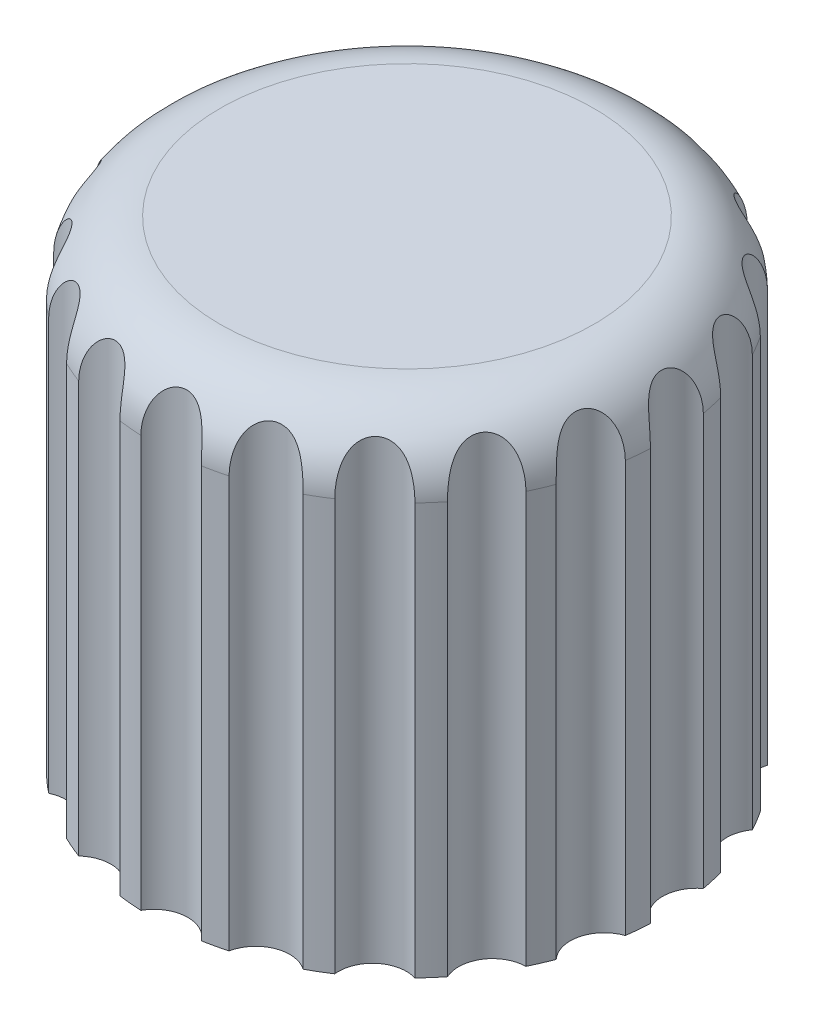
from build123d import *

# Parameters (mm, degrees)
SKETCH1_R           = 7.5
SKETCH1_R_2         = 5.25
SKETCH1_W           = 1
SKETCH1_H           = 14.966629548
BOSS_EXTRUDE1_DEPTH = 12.1
SKETCH4_R           = 7.5
BOSS_EXTRUDE2_DEPTH = 2
FILLET1_R           = 2
CUT_EXTRUDE1_DEPTH  = 20


with BuildPart() as part:
    # Sketch1 → Boss-Extrude1 (new body)
    # profile 1 of 2: a face of its own
    with BuildSketch(Plane(origin=(0, 0, 0), x_dir=(1, 0, 0), z_dir=(0, 1, 0))):
        Circle(SKETCH1_R)
        Circle(SKETCH1_R_2, mode=Mode.SUBTRACT)
    # profile 2 of 2: a face of its own
    with BuildSketch(Plane(origin=(0, 0, 0), x_dir=(1, 0, 0), z_dir=(0, 1, 0))):
        Rectangle(SKETCH1_W, SKETCH1_H)
    extrude(amount=BOSS_EXTRUDE1_DEPTH)

    # Sketch4 → Boss-Extrude2 (add)
    with BuildSketch(Plane(origin=(0, 12.1, 0), x_dir=(1, 0, 0), z_dir=(0, 1, 0))):
        Circle(SKETCH4_R)
    extrude(amount=BOSS_EXTRUDE2_DEPTH)

    # Fillet1
    fillet1_edges = [part.edges().sort_by_distance(p)[0] for p in [
        (-7.5, 14.1, 0),
    ]]
    fillet(fillet1_edges, radius=FILLET1_R)

    # Sketch5 → Cut-Extrude1 (cut)
    with BuildSketch(Plane(origin=(0, 14.1, 0), x_dir=(1, 0, 0), z_dir=(0, 1, 0))):
        with BuildLine():
            ThreePointArc((7.986628338, -0.462350289), (7.981913601, 0.537638597), (7.852481465, 1.529226879))
            ThreePointArc((7.852481465, 1.529226879), (6.984174401, 0.470433772), (7.986628338, -0.462350289))
        make_face()
        with BuildLine():
            ThreePointArc((6.995596572, 3.880931409), (6.496972545, 2.605637686), (7.738609021, 2.028282629))
            ThreePointArc((7.738609021, 2.028282629), (7.42511148, 2.977871641), (6.995596572, 3.880931409))
        make_face()
        with BuildLine():
            ThreePointArc((7.452860828, -2.907725139), (7.757390406, -1.955222259), (7.94071076, -0.972169032))
            ThreePointArc((7.94071076, -0.972169032), (6.787716606, -1.710819477), (7.452860828, -2.907725139))
        make_face()
        with BuildLine():
            ThreePointArc((5.453933946, 5.852743332), (5.373801749, 4.485783629), (6.733080734, 4.320373112))
            ThreePointArc((6.733080734, 4.320373112), (6.141487713, 5.126609862), (5.453933946, 5.852743332))
        make_face()
        with BuildLine():
            ThreePointArc((6.189555372, -5.068471594), (6.773519789, -4.256692338), (7.25164796, -3.378402265))
            ThreePointArc((7.25164796, -3.378402265), (5.926829816, -3.724605796), (6.189555372, -5.068471594))
        make_face()
        with BuildLine():
            ThreePointArc((3.378402265, 7.25164796), (3.724605796, 5.926829816), (5.068471594, 6.189555372))
            ThreePointArc((5.068471594, 6.189555372), (4.256692338, 6.773519789), (3.378402265, 7.25164796))
        make_face()
        with BuildLine():
            ThreePointArc((4.320373112, -6.733080734), (5.126609862, -6.141487713), (5.852743332, -5.453933946))
            ThreePointArc((5.852743332, -5.453933946), (4.485783629, -5.373801749), (4.320373112, -6.733080734))
        make_face()
        with BuildLine():
            ThreePointArc((0.972169032, 7.94071076), (1.710819477, 6.787716606), (2.907725139, 7.452860828))
            ThreePointArc((2.907725139, 7.452860828), (1.955222259, 7.757390406), (0.972169032, 7.94071076))
        make_face()
        with BuildLine():
            ThreePointArc((2.028282629, -7.738609021), (2.977871641, -7.42511148), (3.880931409, -6.995596572))
            ThreePointArc((3.880931409, -6.995596572), (2.605637686, -6.496972545), (2.028282629, -7.738609021))
        make_face()
        with BuildLine():
            ThreePointArc((-1.529226879, 7.852481465), (-0.470433772, 6.984174401), (0.462350289, 7.986628338))
            ThreePointArc((0.462350289, 7.986628338), (-0.537638597, 7.981913601), (-1.529226879, 7.852481465))
        make_face()
        with BuildLine():
            ThreePointArc((-0.462350289, -7.986628338), (0.537638597, -7.981913601), (1.529226879, -7.852481465))
            ThreePointArc((1.529226879, -7.852481465), (0.470433772, -6.984174401), (-0.462350289, -7.986628338))
        make_face()
        with BuildLine():
            ThreePointArc((-3.880931409, 6.995596572), (-2.605637686, 6.496972545), (-2.028282629, 7.738609021))
            ThreePointArc((-2.028282629, 7.738609021), (-2.977871641, 7.42511148), (-3.880931409, 6.995596572))
        make_face()
        with BuildLine():
            ThreePointArc((-2.907725139, -7.452860828), (-1.955222259, -7.757390406), (-0.972169032, -7.94071076))
            ThreePointArc((-0.972169032, -7.94071076), (-1.710819477, -6.787716606), (-2.907725139, -7.452860828))
        make_face()
        with BuildLine():
            ThreePointArc((-5.852743332, 5.453933946), (-4.485783629, 5.373801749), (-4.320373112, 6.733080734))
            ThreePointArc((-4.320373112, 6.733080734), (-5.126609862, 6.141487713), (-5.852743332, 5.453933946))
        make_face()
        with BuildLine():
            ThreePointArc((-5.068471594, -6.189555372), (-4.256692338, -6.773519789), (-3.378402265, -7.25164796))
            ThreePointArc((-3.378402265, -7.25164796), (-3.724605796, -5.926829816), (-5.068471594, -6.189555372))
        make_face()
        with BuildLine():
            ThreePointArc((-7.25164796, 3.378402265), (-5.926829816, 3.724605796), (-6.189555372, 5.068471594))
            ThreePointArc((-6.189555372, 5.068471594), (-6.773519789, 4.256692338), (-7.25164796, 3.378402265))
        make_face()
        with BuildLine():
            ThreePointArc((-6.733080734, -4.320373112), (-6.141487713, -5.126609862), (-5.453933946, -5.852743332))
            ThreePointArc((-5.453933946, -5.852743332), (-5.373801749, -4.485783629), (-6.733080734, -4.320373112))
        make_face()
        with BuildLine():
            ThreePointArc((-7.94071076, 0.972169032), (-6.787716606, 1.710819477), (-7.452860828, 2.907725139))
            ThreePointArc((-7.452860828, 2.907725139), (-7.757390406, 1.955222259), (-7.94071076, 0.972169032))
        make_face()
        with BuildLine():
            ThreePointArc((-7.738609021, -2.028282629), (-7.42511148, -2.977871641), (-6.995596572, -3.880931409))
            ThreePointArc((-6.995596572, -3.880931409), (-6.496972545, -2.605637686), (-7.738609021, -2.028282629))
        make_face()
        with BuildLine():
            ThreePointArc((-7.852481465, -1.529226879), (-6.984174401, -0.470433772), (-7.986628338, 0.462350289))
            ThreePointArc((-7.986628338, 0.462350289), (-7.981913601, -0.537638597), (-7.852481465, -1.529226879))
        make_face()
    extrude(amount=-CUT_EXTRUDE1_DEPTH, mode=Mode.SUBTRACT)


solid = part.part
